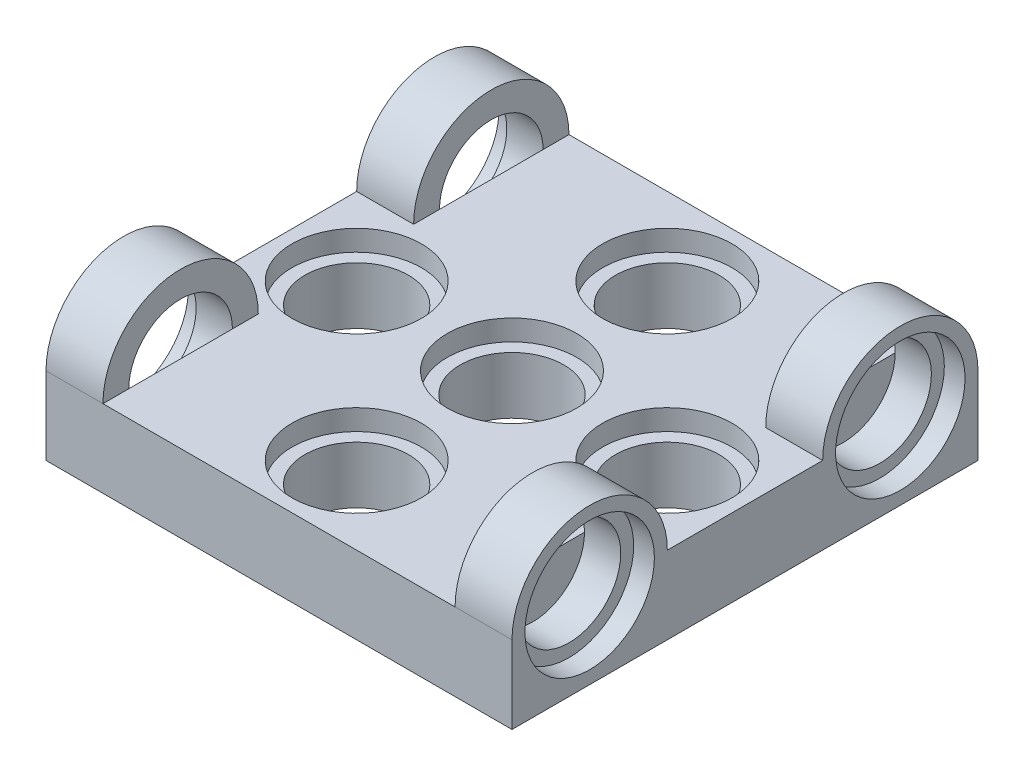
from build123d import *
from build123d.topology import SkipClean

# Parameters (mm, degrees)
SKETCH1_W                  = 9
SKETCH1_H                  = 9
BOSS_EXTRUDE1_DEPTH        = 3
HOLE1_AT_2_COUNT           = 2
HOLE1_AT_2_PITCH           = 6
HOLE1_AT_3_COUNT           = 2
HOLE1_AT_3_PITCH           = 6
BOSS_EXTRUDE2_DEPTH        = 2.2
HOLE2_D                    = 4
HOLE2_DEPTH                = 2.2
HOLE2_CBORE_D              = 5
HOLE2_CBORE_DEPTH          = 0.8
MIRROR2_COPY_3_SKETCH_W    = 9
MIRROR2_COPY_3_SKETCH_H    = 9
MIRROR2_COPY_3_DEPTH       = 3
MIRROR2_COPY_5_DEPTH       = 2.2
MIRROR2_COPY_6_D           = 4
MIRROR2_COPY_6_DEPTH       = 2.2
MIRROR2_COPY_6_CBORE_D     = 5
MIRROR2_COPY_6_CBORE_DEPTH = 0.8


with BuildPart() as part:
    # Sketch1 → Boss-Extrude1 (new body)
    with BuildSketch(Plane(origin=(0, 0, 0), x_dir=(1, 0, 0), z_dir=(0, 1, 0))):
        with Locations((4.5, 0)):
            Rectangle(SKETCH1_W, SKETCH1_H)
    boss_extrude1 = extrude(amount=-BOSS_EXTRUDE1_DEPTH)

    # Sketch5 → Hole1 (revolve, cut)
    with BuildSketch(Plane(origin=(9, 0, 4.5), x_dir=(0, 0, 1), z_dir=(1, 0, 0))):
        Polygon((0, 0), (0, 4.201721238), (2, 3), (2, 0.8), (2.5, 0.8), (2.5, 0), align=None)
    hole1 = revolve(axis=Axis((9, 11.310875039, 4.5), (0, -1, 0)), mode=Mode.SUBTRACT)

    # Hole1 at 2: Hole1 ×2
    with Locations(*[(0, 0, -i * HOLE1_AT_2_PITCH) for i in range(1, HOLE1_AT_2_COUNT)]):
        add(hole1, mode=Mode.SUBTRACT)

    # Hole1 at 3: Hole1 ×2
    with Locations(*[(-i * HOLE1_AT_3_PITCH, 0, 0) for i in range(1, HOLE1_AT_3_COUNT)]):
        add(hole1, mode=Mode.SUBTRACT)

    # Sketch6 → Boss-Extrude2 (add)
    with BuildSketch(Plane(origin=(0, 0, 0), x_dir=(0, 0, -1), z_dir=(1, 0, 0))):
        with BuildLine():
            Line((4.5, 0), (-1.5, 0))
            ThreePointArc((-1.5, 0), (1.5, 3), (4.5, 0))
        make_face()
    boss_extrude2 = extrude(amount=BOSS_EXTRUDE2_DEPTH)

    # Hole2
    with Locations(Plane.ZY):
        with Locations((-1.5, 0)):
            hole2 = CounterBoreHole(HOLE2_D / 2, HOLE2_CBORE_D / 2, HOLE2_CBORE_DEPTH, depth=HOLE2_DEPTH)

    # Mirror1: Boss-Extrude1, Hole1, Boss-Extrude2, Hole2 across plane
    add(boss_extrude1.mirror(Plane.XY.offset(4.5)))
    add(hole1.mirror(Plane.XY.offset(4.5)), mode=Mode.SUBTRACT)
    add(boss_extrude2.mirror(Plane.XY.offset(4.5)))
    add(hole2.mirror(Plane.XY.offset(4.5)), mode=Mode.SUBTRACT)

    # Mirror1 copy 1 sketch → Mirror1 copy 1 (revolve, cut)
    with BuildSketch(Plane(origin=(9, 0, 10.5), x_dir=(0, 0, -1), z_dir=(1, 0, 0))):
        Polygon((0, 0), (0, -4.201721238), (2, -3), (2, -0.8), (2.5, -0.8), (2.5, 0), align=None)
    revolve(axis=Axis((9, 11.310875039, 10.5), (0, 1, 0)), mode=Mode.SUBTRACT)

    # Mirror1 copy 2 sketch → Mirror1 copy 2 (revolve, cut)
    with BuildSketch(Plane(origin=(3, 0, 4.5), x_dir=(0, 0, -1), z_dir=(1, 0, 0))):
        Polygon((0, 0), (0, -4.201721238), (2, -3), (2, -0.8), (2.5, -0.8), (2.5, 0), align=None)
    revolve(axis=Axis((3, 11.310875039, 4.5), (0, 1, 0)), mode=Mode.SUBTRACT)

    # Mirror2: Boss-Extrude1, Hole1, Boss-Extrude2, Hole2 across plane
    with SkipClean():  # the faces are left unmerged after this step: merging them gives an invalid solid
        add(boss_extrude1.mirror(Plane(origin=(9, 0, 0), x_dir=(0, 0, 1), z_dir=(1, 0, 0))))
        add(hole1.mirror(Plane(origin=(9, 0, 0), x_dir=(0, 0, 1), z_dir=(1, 0, 0))), mode=Mode.SUBTRACT)
        add(boss_extrude2.mirror(Plane(origin=(9, 0, 0), x_dir=(0, 0, 1), z_dir=(1, 0, 0))))
        add(hole2.mirror(Plane(origin=(9, 0, 0), x_dir=(0, 0, 1), z_dir=(1, 0, 0))), mode=Mode.SUBTRACT)

    # Mirror2 copy 1 sketch → Mirror2 copy 1 (revolve, cut)
    with SkipClean():  # the faces are left unmerged after this step: merging them gives an invalid solid
        with BuildSketch(Plane(origin=(9, 0, -1.5), x_dir=(0, 0, 1), z_dir=(-1, 0, 0))):
            Polygon((0, 0), (0, -4.201721238), (2, -3), (2, -0.8), (2.5, -0.8), (2.5, 0), align=None)
        revolve(axis=Axis((9, 11.310875039, -1.5), (0, 1, 0)), mode=Mode.SUBTRACT)
    add(part.part.scale(1), mode=Mode.REPLACE)  # the faces are merged on a copy

    # Mirror2 copy 2 sketch → Mirror2 copy 2 (revolve, cut)
    with BuildSketch(Plane(origin=(15, 0, 4.5), x_dir=(0, 0, 1), z_dir=(-1, 0, 0))):
        Polygon((0, 0), (0, -4.201721238), (2, -3), (2, -0.8), (2.5, -0.8), (2.5, 0), align=None)
    revolve(axis=Axis((15, 11.310875039, 4.5), (0, 1, 0)), mode=Mode.SUBTRACT)

    # Mirror2 copy 3 sketch → Mirror2 copy 3 (add)
    with BuildSketch(Plane(origin=(18, 0, 9), x_dir=(-1, 0, 0), z_dir=(0, 1, 0))):
        with Locations((4.5, 0)):
            Rectangle(MIRROR2_COPY_3_SKETCH_W, MIRROR2_COPY_3_SKETCH_H)
    extrude(amount=-MIRROR2_COPY_3_DEPTH)

    # Mirror2 copy 4 sketch → Mirror2 copy 4 (revolve, cut)
    with BuildSketch(Plane(origin=(9, 0, 4.5), x_dir=(0, 0, -1), z_dir=(-1, 0, 0))):
        Polygon((0, 0), (0, 4.201721238), (2, 3), (2, 0.8), (2.5, 0.8), (2.5, 0), align=None)
    revolve(axis=Axis((9, 11.310875039, 4.5), (0, -1, 0)), mode=Mode.SUBTRACT)

    # Mirror2 copy 5 sketch → Mirror2 copy 5 (add)
    with BuildSketch(Plane(origin=(18, 0, 9), x_dir=(0, 0, 1), z_dir=(-1, 0, 0))):
        with BuildLine():
            Line((4.5, 0), (-1.5, 0))
            ThreePointArc((-1.5, 0), (1.5, 3), (4.5, 0))
        make_face()
    extrude(amount=MIRROR2_COPY_5_DEPTH)

    # Mirror2 copy 6
    with Locations(Plane(origin=(18, 0, 9), x_dir=(0, 0, -1), z_dir=(1, 0, 0))):
        with Locations((-1.5, 0)):
            CounterBoreHole(MIRROR2_COPY_6_D / 2, MIRROR2_COPY_6_CBORE_D / 2, MIRROR2_COPY_6_CBORE_DEPTH, depth=MIRROR2_COPY_6_DEPTH)

    # Mirror2 copy 7 sketch → Mirror2 copy 7 (revolve, cut)
    with BuildSketch(Plane(origin=(9, 0, 10.5), x_dir=(0, 0, -1), z_dir=(-1, 0, 0))):
        Polygon((0, 0), (0, 4.201721238), (2, 3), (2, 0.8), (2.5, 0.8), (2.5, 0), align=None)
    revolve(axis=Axis((9, 11.310875039, 10.5), (0, -1, 0)), mode=Mode.SUBTRACT)

    # Mirror2 copy 8 sketch → Mirror2 copy 8 (revolve, cut)
    with SkipClean():  # the faces are left unmerged after this step: merging them gives an invalid solid
        with BuildSketch(Plane(origin=(15, 0, 4.5), x_dir=(0, 0, -1), z_dir=(-1, 0, 0))):
            Polygon((0, 0), (0, 4.201721238), (2, 3), (2, 0.8), (2.5, 0.8), (2.5, 0), align=None)
        revolve(axis=Axis((15, 11.310875039, 4.5), (0, -1, 0)), mode=Mode.SUBTRACT)
    add(part.part.scale(1), mode=Mode.REPLACE)  # the faces are merged on a copy


solid = part.part
